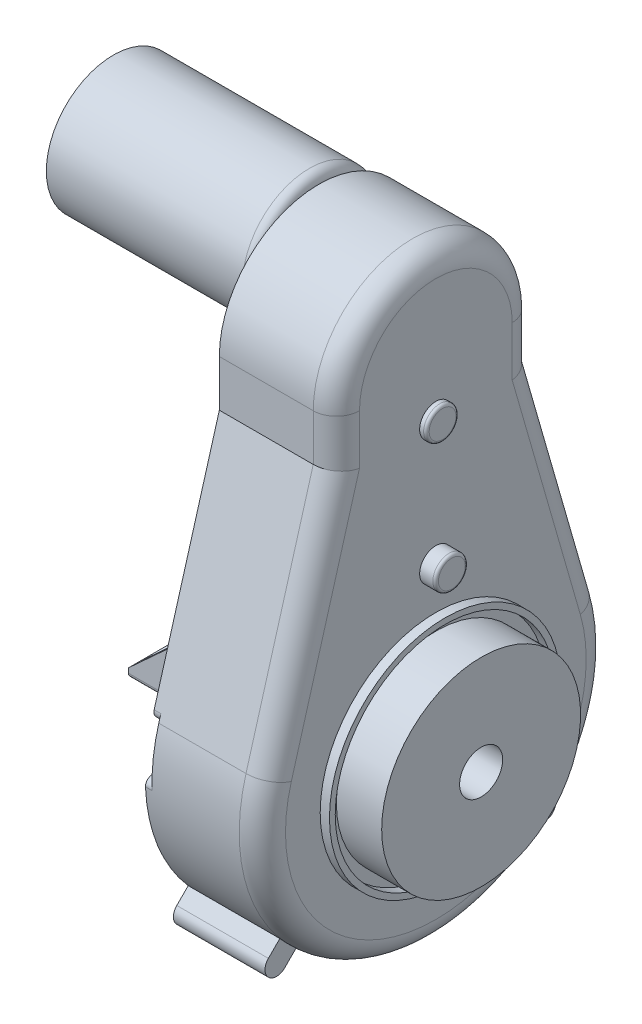
from build123d import *

# Parameters (mm, degrees)
BOSS_EXTRUDE1_DEPTH      = 32.131
FILLET1_R                = 6.35
CUT_EXTRUDE1_DEPTH       = 1.8415
SKETCH3_R                = 18.414999999999996
BOSS_EXTRUDE2_DEPTH      = 56.388
FILLET2_R                = 2.54
SKETCH4_R                = 31.75
SKETCH4_R_2              = 30.1625
BOSS_EXTRUDE3_DEPTH      = 2.54
SKETCH5_R                = 27.305
BOSS_EXTRUDE4_DEPTH      = 12.4333
BOSS_EXTRUDE5_DEPTH      = 25.145999999999997
BOSS_EXTRUDE6_DEPTH      = 1.8541999999999998
BOSS_EXTRUDE6_DEPTH_BACK = 34.6837
SKETCH7_R                = 4.444999999999999
BOSS_EXTRUDE7_DEPTH      = 4.394199999999999
BOSS_EXTRUDE7_DEPTH_BACK = 32.1437
SKETCH8_R                = 4.444999999999999
FILLET3_R                = 0.762
SKETCH9_R                = 5.9055
CUT_EXTRUDE2_DEPTH       = 142.64185652641663
SKETCH10_W               = 134.21284559698992
SKETCH10_H               = 12.699999999999998
CUT_EXTRUDE3_DEPTH       = 142.64185652641663
FILLET4_R                = 1.905
BOSS_EXTRUDE8_DEPTH      = 15.239999999999998
FILLET5_R                = 1.27
CUT_EXTRUDE4_DEPTH       = 159.3136378774741
BOSS_EXTRUDE9_DEPTH      = 6.35


with BuildPart() as part:
    # Sketch1 → Boss-Extrude1 (new body)
    with BuildSketch(Plane(origin=(0, 0, 0), x_dir=(0, 0, -1), z_dir=(1, 0, 0))):
        with BuildLine():
            Line((-27.305000000000003, 90.17), (-27.305, 77.40650000000001))
            Line((-27.305, 77.40650000000001), (-45.77190734137806, 13.155725876298133))
            ThreePointArc((-45.77190734137806, 13.155725876298133), (-8.75e-15, -47.62499999999999), (45.77190734137806, 13.155725876298133))
            Line((45.77190734137806, 13.155725876298133), (27.305, 77.40650000000001))
            Line((27.305, 77.40650000000001), (27.305000000000003, 90.17))
            ThreePointArc((27.305000000000003, 90.17), (1.67e-15, 117.47500000000001), (-27.305000000000003, 90.17))
        make_face()
    extrude(amount=BOSS_EXTRUDE1_DEPTH)

    # Fillet1
    fillet1_edges = [part.edges().sort_by_distance(p)[0] for p in [
        (32.131, 45.28111293814907, 36.53845367068903),
        (32.131, -47.62499999999999, 8.88e-15),
        (32.131, 45.28111293814907, -36.53845367068903),
        (32.131, 83.78825, -27.305),
        (32.131, 117.47500000000001, -1.67e-15),
        (32.131, 83.78825, 27.305),
    ]]
    fillet(fillet1_edges, radius=FILLET1_R)

    # Sketch2 → Cut-Extrude1 (cut)
    with BuildSketch(Plane.ZY):
        with BuildLine():
            Line((-22.542499999999997, 90.17), (-22.542499999999997, 77.40650000000001))
            Line((-22.542499999999997, 77.40650000000001), (-41.22672379287508, 11.72822030642276))
            ThreePointArc((-41.22672379287508, 11.72822030642276), (-7.87e-15, -42.86249999999999), (41.22672379287508, 11.72822030642276))
            Line((41.22672379287508, 11.72822030642276), (22.542499999999997, 77.4065))
            Line((22.542499999999997, 77.4065), (22.542499999999997, 90.17))
            ThreePointArc((22.542499999999997, 90.17), (1.38e-15, 112.7125), (-22.542499999999997, 90.17))
        make_face()
    extrude(amount=-CUT_EXTRUDE1_DEPTH, mode=Mode.SUBTRACT)

    # Sketch4 → Boss-Extrude3 (add)
    with BuildSketch(Plane(origin=(32.131, 0, 0), x_dir=(0, 0, -1), z_dir=(1, 0, 0))):
        with Locations(Location((0, 0, 0), (0, 0, 180))):
            Circle(SKETCH4_R)
        Circle(SKETCH4_R_2, mode=Mode.SUBTRACT)
    extrude(amount=BOSS_EXTRUDE3_DEPTH)

    # Sketch5 → Boss-Extrude4 (add)
    with BuildSketch(Plane(origin=(32.131, 0, 0), x_dir=(0, 0, -1), z_dir=(1, 0, 0))):
        with Locations(Location((0, 0, 0), (0, 0, 180))):
            Circle(SKETCH5_R)
    extrude(amount=BOSS_EXTRUDE4_DEPTH)

    # Sketch6 → Boss-Extrude5 (add)
    with BuildSketch(Plane.ZY):
        with BuildLine():
            Line((34.49906726262701, -38.989195323161965), (31.355977620252823, -35.84610568078774))
            Line((31.355977620252823, -35.84610568078774), (35.84610568078741, -31.35597762025319))
            Line((35.84610568078741, -31.35597762025319), (38.9891953231616, -34.49906726262742))
            ThreePointArc((38.9891953231616, -34.49906726262742), (38.989195323161574, -38.98919532316199), (34.49906726262701, -38.989195323161965))
        make_face()
        with BuildLine():
            Line((-38.98919532316209, -34.49906726262692), (-35.84610568078783, -31.35597762025271))
            Line((-35.84610568078783, -31.35597762025271), (-31.35597762025329, -35.846105680787325))
            Line((-31.35597762025329, -35.846105680787325), (-34.499067262627555, -38.98919532316154))
            ThreePointArc((-34.499067262627555, -38.98919532316154), (-38.98919532316211, -38.9891953231614), (-38.98919532316209, -34.49906726262692))
        make_face()
    extrude(amount=-BOSS_EXTRUDE5_DEPTH)

    # Sketch7 → Boss-Extrude6 (add, two sides: drawn at the far end of the back side and taken through both)
    with BuildSketch(Plane(origin=(32.131, 0, 0), x_dir=(0, 0, -1), z_dir=(1, 0, 0)).offset(-BOSS_EXTRUDE6_DEPTH_BACK)):
        with Locations((0, 77.47000000000001)):
            Circle(SKETCH7_R)
    extrude(amount=BOSS_EXTRUDE6_DEPTH + BOSS_EXTRUDE6_DEPTH_BACK)

    # Sketch8 → Boss-Extrude7 (add, two sides: drawn at the far end of the back side and taken through both)
    with BuildSketch(Plane(origin=(32.131, 0, 0), x_dir=(0, 0, -1), z_dir=(1, 0, 0)).offset(-BOSS_EXTRUDE7_DEPTH_BACK)):
        with Locations((0, 43.18000000000001)):
            Circle(SKETCH8_R)
    extrude(amount=BOSS_EXTRUDE7_DEPTH + BOSS_EXTRUDE7_DEPTH_BACK)

    # Fillet3
    fillet3_edges = [part.edges().sort_by_distance(p)[0] for p in [
        (-2.5527000000000015, 77.47000000000001, 4.444999999999999),
        (33.9852, 77.47000000000001, 4.444999999999999),
        (-0.01270000000000238, 43.18000000000001, 4.444999999999999),
        (36.5252, 43.18000000000001, 4.444999999999999),
    ]]
    fillet(fillet3_edges, radius=FILLET3_R)

    # Sketch9 → Cut-Extrude2 (cut, through all)
    with BuildSketch(Plane.ZY.offset(-1.8415)):
        Circle(SKETCH9_R)
    extrude(amount=-CUT_EXTRUDE2_DEPTH, mode=Mode.SUBTRACT)

    # Sketch10 → Cut-Extrude3 (cut, through all)
    with BuildSketch(Plane.ZY.offset(-1.8415)):
        with Locations((0, 6.349999999999999)):
            Rectangle(SKETCH10_W, SKETCH10_H)
    extrude(amount=CUT_EXTRUDE3_DEPTH, mode=Mode.SUBTRACT)

    # Fillet4
    # the kernel refuses this fillet: 1.905 mm, written as the material it takes off along each edge
    with BuildSketch(Plane(origin=(1.8415, 0, -47.624999999999986), x_dir=(0, -0.9997828682661093, 0.020837857893547872), z_dir=(-1, 0, 0))) as fillet4_piece_1:
        with BuildLine():
            CenterArc((1.9451098450732716, 1.9045863640469403), FILLET4_R, 178.80599226836884, 92.38801546326556)
            Line((0.04052348102633122, 1.9442824833340424), (0, 0))
            ThreePointArc((0, 0), (0.9924029821802466, -0.01034089882655586), (1.984805964360482, 0))
        make_face()
    extrude(amount=6.803514910901205, mode=Mode.SUBTRACT)
    with BuildSketch(Plane(origin=(1.8415, 0, -42.86249999999998), x_dir=(0, 0, -1), z_dir=(-1, 0, 0))) as fillet4_piece_2:
        with BuildLine():
            CenterArc((1.8644497199396994, 1.9049999999999998), FILLET4_R, 182.43885469094968, 87.56114530905029)
            ThreePointArc((-0.03882473622794436, 1.8239361702127719), (-0.0097072832853442, 0.9121746698348945), (0, 0))
            Line((0, 0), (1.8644497199396994, 0))
        make_face()
    extrude(amount=6.5026242998492485, mode=Mode.SUBTRACT)
    with BuildSketch(Plane(origin=(1.8415, 0, 42.8625), x_dir=(0, -0.9997735250327126, -0.021281415452547647), z_dir=(-1, 0, 0))) as fillet4_piece_3:
        with BuildLine():
            CenterArc((1.8648904361068899, 1.9045685651873139), FILLET4_R, 181.2194273454691, 87.56114530905586)
            Line((-0.03967812908043138, 1.8640274687504024), (0, 0))
            ThreePointArc((0, 0), (0.9121746698348924, 0.00970728328536713), (1.8243493396697803, 0))
        make_face()
    extrude(amount=6.502624299849337, mode=Mode.SUBTRACT)
    with BuildSketch(Plane(origin=(1.8415, 0, 47.625), x_dir=(0, -0.9997828682661093, -0.02083785789354795), z_dir=(-1, 0, 0))) as fillet4_piece_4:
        with BuildLine():
            CenterArc((1.945109845073265, -1.9045863640469403), FILLET4_R, 88.8059922683656, 92.3880154632651)
            Line((0.04052348102632441, -1.9442824833340282), (0, 0))
            ThreePointArc((0, 0), (0.9924029821802345, 0.01034089882654147), (1.984805964360475, 0))
        make_face()
    extrude(amount=6.803514910901187, mode=Mode.SUBTRACT)
    with BuildSketch(Plane(origin=(1.8415, 12.7, 45.90044253599305), x_dir=(0, 0, -1), z_dir=(-1, 0, 0))) as fillet4_piece_5:
        with BuildLine():
            CenterArc((2.5272090639859783, -1.9049999999999994), FILLET4_R, 90, 106.03566818225914)
            Line((0.696332770330855, -2.431229035051931), (0.5132451409653456, -2.483851938557125))
            ThreePointArc((0.5132451409653456, -2.483851938557125), (-0.0545524347505264, -0.5083487798033133), (-0.18360177014397294, -0.05080000000000062))
            Line((-0.18360177014397294, -0.05080000000000062), (0, 0.1905000000000001))
            Line((0, 0.1905000000000001), (2.5272090639859783, 0.1905000000000001))
            Line((2.5272090639859783, 0.1905000000000001), (2.5272090639859783, 0))
        make_face()
    extrude(amount=8.163956972924069, mode=Mode.SUBTRACT)
    with BuildSketch(Plane(origin=(1.8415, 12.7, 40.95027091748187), x_dir=(0, 0, 1), z_dir=(-1, 0, 0))) as fillet4_piece_6:
        with BuildLine():
            CenterArc((FILLET4_R * 0.755196552848, FILLET4_R), FILLET4_R, 195.8800464533219, 74.11995354667806)
            Line((-FILLET4_R * 0.206640106071, FILLET4_R * 0.726375729217), (0, 0))
            Line((0, 0), (FILLET4_R * 0.755196552848, 0))
        make_face()
    extrude(amount=5.438123582936443, mode=Mode.SUBTRACT)
    with BuildSketch(Plane(origin=(-3.596623582936438, 12.700000000000003, -40.950270917481866), x_dir=(0, 0.9618366589180548, 0.27362427078268), z_dir=(1, 0, 0))) as fillet4_piece_7:
        with BuildLine():
            CenterArc((FILLET4_R * 0.755196552848, -FILLET4_R), FILLET4_R, 90.00000000000018, 74.11995354667768)
            Line((-FILLET4_R * 0.206640106071, -FILLET4_R * 0.726375729217), (0, 0))
            Line((0, 0), (FILLET4_R * 0.755196552848, 4e-17))
        make_face()
    extrude(amount=5.438123582936438, mode=Mode.SUBTRACT)
    with BuildSketch(Plane(origin=(1.8415, 12.7, -45.90044253599304), x_dir=(0, 0, 1), z_dir=(-1, 0, 0))) as fillet4_piece_8:
        with BuildLine():
            CenterArc((2.5272090639859712, 1.9049999999999994), FILLET4_R, 163.96433181774108, 106.03566818225892)
            Line((0.696332770330848, 2.431229035051924), (0.5132451409653385, 2.483851938557116))
            ThreePointArc((0.5132451409653385, 2.483851938557116), (-0.05455243475053351, 0.5083487798033257), (-0.18360177014397294, 0.05080000000000062))
            Line((-0.18360177014397294, 0.05080000000000062), (0, -0.1905000000000001))
            Line((0, -0.1905000000000001), (2.5272090639859712, -0.1905000000000001))
            Line((2.5272090639859712, -0.1905000000000001), (2.5272090639859712, 0))
        make_face()
    extrude(amount=8.163956972924046, mode=Mode.SUBTRACT)

    # Sketch11 → Boss-Extrude8 (add)
    with BuildSketch(Plane.ZY.offset(-1.8415)):
        Polygon((-38.862, 12.7), (-12.954, 12.7), (-12.954, 29.21), (-15.494000000000002, 29.21), (-15.494000000000002, 15.239999999999998), (-24.638, 15.239999999999998), (-24.638, 29.21), (-27.178, 29.21), (-27.178, 15.239999999999998), (-36.322, 15.239999999999998), (-36.322, 29.21), (-38.862, 29.21), align=None)
        Polygon((12.954, 29.21), (12.954, 12.7), (38.862, 12.700000000000001), (38.861999999999995, 29.21), (36.322, 29.21), (36.322, 15.239999999999998), (27.178000000000004, 15.239999999999998), (27.178000000000004, 29.21), (24.63800000000001, 29.21), (24.638000000000005, 15.239999999999998), (15.494000000000007, 15.239999999999998), (15.494000000000007, 29.21), align=None)
    extrude(amount=BOSS_EXTRUDE8_DEPTH)

    # Fillet5
    fillet5_edges = [part.edges().sort_by_distance(p)[0] for p in [
        (-5.778499999999999, 12.7, -38.862),
        (-5.778499999999999, 12.7, -12.954),
        (-5.778499999999999, 15.239999999999998, -15.494000000000002),
        (-5.778499999999999, 15.239999999999998, -24.638),
        (-5.778499999999999, 15.239999999999998, -27.178),
        (-5.778499999999999, 15.239999999999998, -36.322),
        (-5.778499999999999, 12.7, 12.954),
        (-5.778499999999999, 12.700000000000001, 38.862),
        (-5.778499999999999, 15.239999999999998, 36.322),
        (-5.778499999999999, 15.239999999999998, 27.178000000000004),
        (-5.778499999999999, 15.239999999999998, 24.638000000000005),
        (-5.778499999999999, 15.239999999999998, 15.494000000000007),
    ]]
    fillet(fillet5_edges, radius=FILLET5_R)

    # Sketch12 → Cut-Extrude4 (cut, through all)
    with BuildSketch(Plane(origin=(0, 0, -38.862), x_dir=(-1, 0, 0), z_dir=(0, 0, -1))):
        Polygon((13.398499999999999, 15.24), (-1.8415, 29.21), (13.398499999999999, 29.21), align=None)
    extrude(amount=-CUT_EXTRUDE4_DEPTH, mode=Mode.SUBTRACT)

    # Sketch13 → Boss-Extrude9 (add)
    with BuildSketch(Plane.ZY):
        Polygon((-36.253489329115546, 29.21), (-38.861999999999995, 20.040633623037603), (-38.862, 29.21), align=None)
        Polygon((36.25348932911554, 29.21), (38.862, 20.04063362303758), (38.861999999999995, 27.52195833333334), (41.64277602355167, 27.52195833333334), (41.157600405485155, 29.21), align=None)
    extrude(amount=-BOSS_EXTRUDE9_DEPTH)


with BuildPart() as body_2:
    # Sketch3 → Boss-Extrude2 (new body)
    with BuildSketch(Plane.ZY):
        with Locations((0, 101.6)):
            Circle(SKETCH3_R)
    extrude(amount=BOSS_EXTRUDE2_DEPTH)

    # Fillet2
    fillet2_edges = [body_2.edges().sort_by_distance(p)[0] for p in [
        (0, 101.6, -18.414999999999996),
    ]]
    fillet(fillet2_edges, radius=FILLET2_R)


solid = Compound([part.part, body_2.part])
